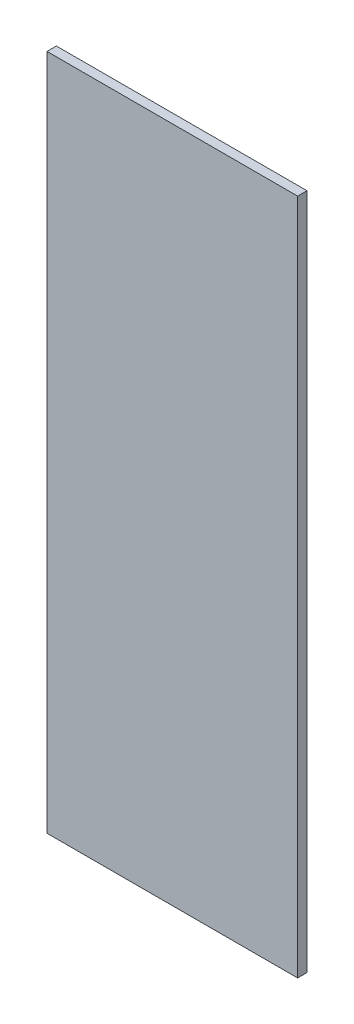
from build123d import *

# Parameters (mm, degrees)
SKETCH1_W      = 107.2
SKETCH1_H      = 289.6
EXTRUDE1_DEPTH = 4


with BuildPart() as part:
    # Sketch1 → Extrude1 (new body)
    with BuildSketch(Plane.XY):
        with Locations((0, -144.8)):
            Rectangle(SKETCH1_W, SKETCH1_H)
    extrude(amount=EXTRUDE1_DEPTH)


solid = part.part
